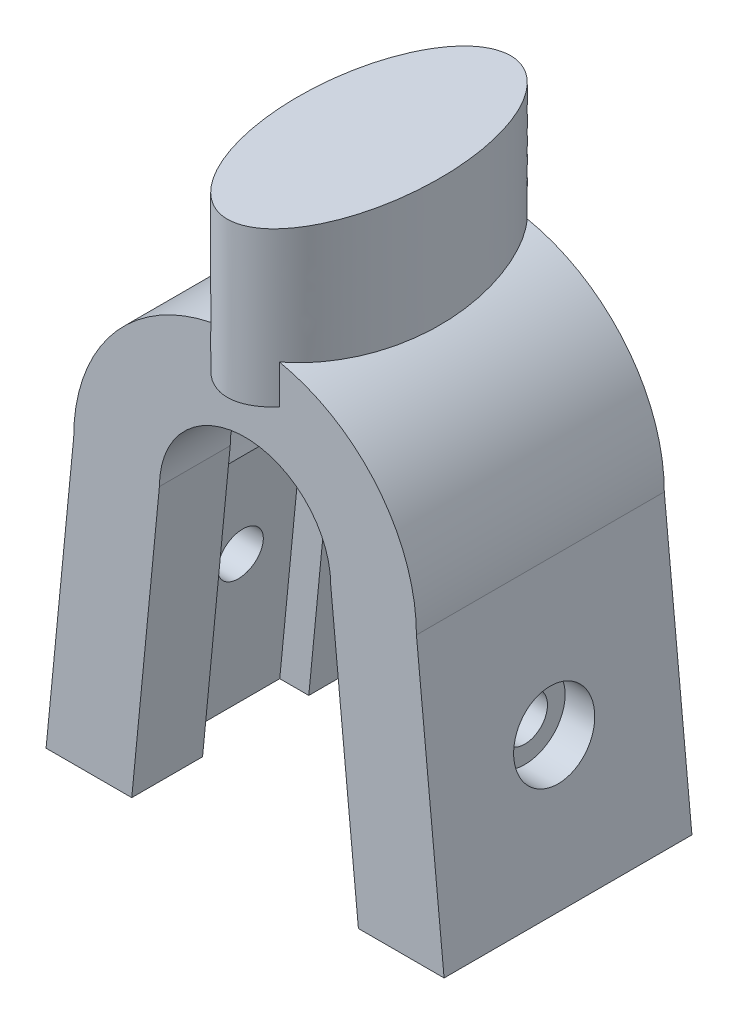
from build123d import *

# Parameters (mm, degrees)
BOSS_EXTRUDE1_DEPTH         = 3.75
BOLT_HOLE_REACH             = 26.729
SKETCH2_R                   = 1.6
BOLT_HOLE_DIRECTION_2_REACH = 26.729
BOSS_EXTRUDE2_START         = 5
BOSS_EXTRUDE2_DEPTH         = 5
CUT_EXTRUDE2_START          = 11
SKETCH4_R                   = 2.85
CUT_EXTRUDE2_DEPTH          = 3
SKETCH7_RX                  = 10
SKETCH7_RY                  = 5


with BuildPart() as part:
    # Sketch1 → Boss-Extrude1 (new, symmetric)
    with BuildSketch(Plane.XY):
        with BuildLine():
            Line((-12.1, 0), (-14.051700625, -20))
            Line((-14.051700625, -20), (-10.051700625, -20))
            Line((-10.051700625, -20), (-8.425, -3.439385846))
            ThreePointArc((-8.425, -3.439385846), (0, 9.1), (8.425, -3.439385846))
            Line((8.425, -3.439385846), (10.051700625, -20))
            Line((10.051700625, -20), (14.051700625, -20))
            Line((14.051700625, -20), (12.1, 0))
            ThreePointArc((12.1, 0), (0, 12.1), (-12.1, 0))
        make_face()
    extrude(amount=BOSS_EXTRUDE1_DEPTH, both=True)

    # Bolt Hole: up to this plane
    bolt_hole_end = Plane(origin=(14.051700625, -20, 3.75), z_dir=(-0.995272319868323, -0.09712368044883128, 0))
    # Sketch2 → Bolt Hole (cut, up to the surface)
    with BuildSketch(Plane(origin=(0, 0, 0), x_dir=(0, 0, -1), z_dir=(1, 0, 0)), mode=Mode.PRIVATE) as bolt_hole_sk1:
        with Locations((0, -10)):
            Circle(SKETCH2_R)
    bolt_hole_tool1 = split(extrude(bolt_hole_sk1.sketch, amount=BOLT_HOLE_REACH, mode=Mode.PRIVATE), bisect_by=bolt_hole_end, keep=Keep.BOTH, mode=Mode.PRIVATE)
    add(bolt_hole_tool1.solids().sort_by_distance((0, -10, 0))[0], mode=Mode.SUBTRACT)

    # Bolt Hole direction 2: up to this plane
    bolt_hole_direction_2_end = Plane(origin=(-12.1, 0, 3.75), z_dir=(0.995272319868323, -0.09712368044883138, 0))
    # Sketch2 → Bolt Hole direction 2 (cut, up to the surface)
    with BuildSketch(Plane(origin=(0, 0, 0), x_dir=(0, 0, -1), z_dir=(1, 0, 0)), mode=Mode.PRIVATE) as bolt_hole_direction_2_sk1:
        with Locations((0, -10)):
            Circle(SKETCH2_R)
    bolt_hole_direction_2_tool1 = split(extrude(bolt_hole_direction_2_sk1.sketch, amount=-BOLT_HOLE_DIRECTION_2_REACH, mode=Mode.PRIVATE), bisect_by=bolt_hole_direction_2_end, keep=Keep.BOTH, mode=Mode.PRIVATE)
    add(bolt_hole_direction_2_tool1.solids().sort_by_distance((0, -10, 0))[0], mode=Mode.SUBTRACT)

    # Sketch3 → Boss-Extrude2 (add)
    with BuildSketch(Plane.XY.offset(3.75).offset(BOSS_EXTRUDE2_START)):
        with BuildLine():
            ThreePointArc((12.1, 0), (0, 12.1), (-12.1, 0))
            Line((-12.1, 0), (-14.051700625, -20))
            Line((-14.051700625, -20), (-8.001700625, -20))
            Line((-8.001700625, -20), (-6.05, 0))
            ThreePointArc((-6.05, 0), (0, 6.05), (6.05, 0))
            Line((6.05, 0), (8.001700625, -20))
            Line((8.001700625, -20), (14.051700625, -20))
            Line((14.051700625, -20), (12.1, 0))
        make_face()
    boss_extrude2 = extrude(amount=-BOSS_EXTRUDE2_DEPTH)

    # Sketch4 → Cut-Extrude2 (cut)
    with BuildSketch(Plane(origin=(0, 0, 0), x_dir=(0, 0, -1), z_dir=(1, 0, 0)).offset(CUT_EXTRUDE2_START)):
        with Locations((0, -10)):
            Circle(SKETCH4_R)
    extrude(amount=CUT_EXTRUDE2_DEPTH, mode=Mode.SUBTRACT)

    # Sweep1: sweep along a path in Sketch8
    with BuildLine(Plane(origin=(0, 0, 0), x_dir=(0, 0, -1), z_dir=(1, 0, 0))) as sweep1_path:
        Line((0, 20), (0, 9.1))
    # Sketch7 → Sweep1 (sweep)
    with BuildSketch(Plane(origin=(0, 20, 0), x_dir=(1, 0, 0), z_dir=(0, 1, 0))):
        with Locations(Location((0, 0), (0, 0, -90))):
            Ellipse(SKETCH7_RX, SKETCH7_RY)
    sweep(path=sweep1_path.line)

    # Mirror2: Boss-Extrude2 across plane
    add(boss_extrude2.mirror(Plane.XY))


solid = part.part
